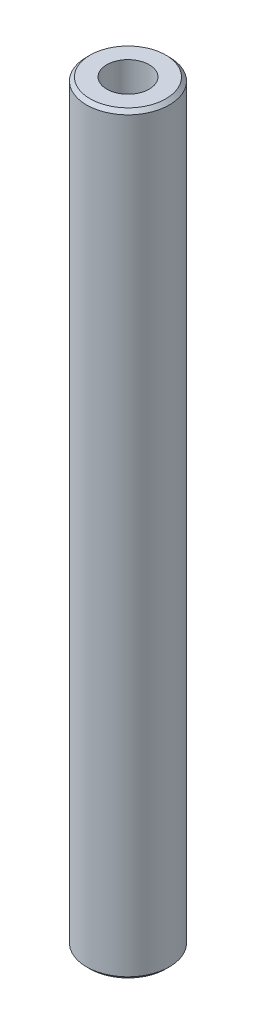
from build123d import *

# Parameters (mm, degrees)
SKETCH1_R           = 27.5
BOSS_EXTRUDE1_DEPTH = 500.211161865
SKETCH2_R           = 14.083230293
CUT_EXTRUDE1_DEPTH  = 502.720745489
CHAMFER1_SIZE       = 2.355758093


with BuildPart() as part:
    # Sketch1 → Boss-Extrude1 (new body)
    with BuildSketch(Plane(origin=(0, 0, 0), x_dir=(1, 0, 0), z_dir=(0, 1, 0))):
        Circle(SKETCH1_R)
    extrude(amount=BOSS_EXTRUDE1_DEPTH)

    # Sketch2 → Cut-Extrude1 (cut, through all)
    with BuildSketch(Plane(origin=(0, 0, 0), x_dir=(1, 0, 0), z_dir=(0, 1, 0))):
        Circle(SKETCH2_R)
    extrude(amount=CUT_EXTRUDE1_DEPTH, mode=Mode.SUBTRACT)

    # Chamfer1
    chamfer1_edges = [part.edges().sort_by_distance(p)[0] for p in [
        (-27.5, 500.211161865, 0),
        (-27.5, 0, 0),
    ]]
    chamfer(chamfer1_edges, length=CHAMFER1_SIZE)


solid = part.part
